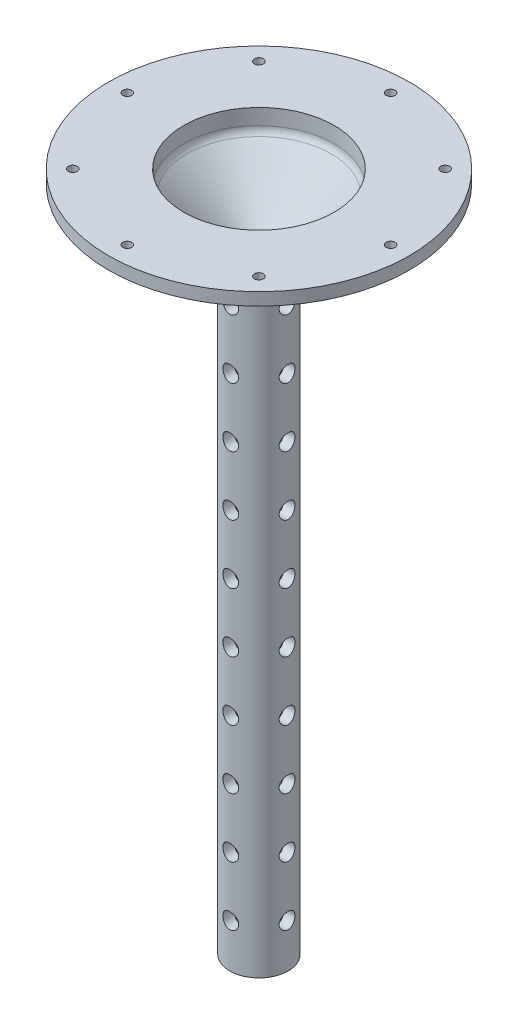
from build123d import *

# Parameters (mm, degrees)
SKETCH1_R                  = 38.1
BOSS_EXTRUDE1_DEPTH        = 3.175
TAP_DRILL_FOR_4_40_TAP1_D  = 2.2606
CIRPATTERN1_COUNT          = 8
SKETCH5_R                  = 25.4
BOSS_EXTRUDE2_DEPTH        = 19.05
CUT_EXTRUDE1_DEPTH         = 59.285252208
CUT_EXTRUDE1_DEPTH_BACK    = 59.285252208
SKETCH6_R                  = 4.7625
SKETCH7_R                  = 19.05
CUT_EXTRUDE2_DEPTH         = 5.08
CHAMFER1_SIZE              = 16.51
FILLET1_R                  = 2.54
FILLET2_R                  = 2.54
BOSS_EXTRUDE3_START        = 150
SKETCH10_R                 = 7.39
SKETCH10_R_2               = 4.7625
BOSS_EXTRUDE3_DEPTH        = 150
SKETCH11_R                 = 2
CUT_EXTRUDE3_DEPTH         = 178.429204287
CIRPATTERN2_COUNT          = 4
LPATTERN1_COUNT            = 10
LPATTERN1_PITCH            = 15
LPATTERN1_COPY_1_SKETCH_R  = 2
LPATTERN1_COPY_1_DEPTH     = 178.429204287
LPATTERN1_COPY_2_SKETCH_R  = 2
LPATTERN1_COPY_2_DEPTH     = 178.429204287
LPATTERN1_COPY_3_SKETCH_R  = 2
LPATTERN1_COPY_3_DEPTH     = 178.429204287
LPATTERN1_COPY_4_SKETCH_R  = 2
LPATTERN1_COPY_4_DEPTH     = 178.429204287
LPATTERN1_COPY_5_SKETCH_R  = 2
LPATTERN1_COPY_5_DEPTH     = 178.429204287
LPATTERN1_COPY_6_SKETCH_R  = 2
LPATTERN1_COPY_6_DEPTH     = 178.429204287
LPATTERN1_COPY_7_SKETCH_R  = 2
LPATTERN1_COPY_7_DEPTH     = 178.429204287
LPATTERN1_COPY_8_SKETCH_R  = 2
LPATTERN1_COPY_8_DEPTH     = 178.429204287
LPATTERN1_COPY_9_SKETCH_R  = 2
LPATTERN1_COPY_9_DEPTH     = 178.429204287
LPATTERN1_COPY_10_SKETCH_R = 2
LPATTERN1_COPY_10_DEPTH    = 178.429204287
LPATTERN1_COPY_11_SKETCH_R = 2
LPATTERN1_COPY_11_DEPTH    = 178.429204287
LPATTERN1_COPY_12_SKETCH_R = 2
LPATTERN1_COPY_12_DEPTH    = 178.429204287
LPATTERN1_COPY_13_SKETCH_R = 2
LPATTERN1_COPY_13_DEPTH    = 178.429204287
LPATTERN1_COPY_14_SKETCH_R = 2
LPATTERN1_COPY_14_DEPTH    = 178.429204287
LPATTERN1_COPY_15_SKETCH_R = 2
LPATTERN1_COPY_15_DEPTH    = 178.429204287
LPATTERN1_COPY_16_SKETCH_R = 2
LPATTERN1_COPY_16_DEPTH    = 178.429204287
LPATTERN1_COPY_17_SKETCH_R = 2
LPATTERN1_COPY_17_DEPTH    = 178.429204287
LPATTERN1_COPY_18_SKETCH_R = 2
LPATTERN1_COPY_18_DEPTH    = 178.429204287
LPATTERN1_COPY_19_SKETCH_R = 2
LPATTERN1_COPY_19_DEPTH    = 178.429204287
LPATTERN1_COPY_20_SKETCH_R = 2
LPATTERN1_COPY_20_DEPTH    = 178.429204287
LPATTERN1_COPY_21_SKETCH_R = 2
LPATTERN1_COPY_21_DEPTH    = 178.429204287
LPATTERN1_COPY_22_SKETCH_R = 2
LPATTERN1_COPY_22_DEPTH    = 178.429204287
LPATTERN1_COPY_23_SKETCH_R = 2
LPATTERN1_COPY_23_DEPTH    = 178.429204287
LPATTERN1_COPY_24_SKETCH_R = 2
LPATTERN1_COPY_24_DEPTH    = 178.429204287
LPATTERN1_COPY_25_SKETCH_R = 2
LPATTERN1_COPY_25_DEPTH    = 178.429204287
LPATTERN1_COPY_26_SKETCH_R = 2
LPATTERN1_COPY_26_DEPTH    = 178.429204287
LPATTERN1_COPY_27_SKETCH_R = 2
LPATTERN1_COPY_27_DEPTH    = 178.429204287


with BuildPart() as part:
    # Sketch1 → Boss-Extrude1 (new body)
    with BuildSketch(Plane(origin=(0, 0, 0), x_dir=(1, 0, 0), z_dir=(0, 1, 0))):
        with Locations(Location((0, 0, 0), (0, 0, 270))):
            Circle(SKETCH1_R)
    extrude(amount=BOSS_EXTRUDE1_DEPTH)

    # Tap Drill for #4-40 Tap1 (through all)
    with Locations(Plane(origin=(0, 0, 0), x_dir=(-1, 0, 0), z_dir=(0, -1, 0))):
        with Locations((0, -33.3375)):
            tap_drill_for_4_40_tap1 = Hole(TAP_DRILL_FOR_4_40_TAP1_D / 2)

    # CirPattern1: Tap Drill for #4-40 Tap1 ×8 about axis
    cirpattern1_axis = Axis((0, 0, 0), (0, 1, 0))
    for i in range(1, CIRPATTERN1_COUNT):
        add(tap_drill_for_4_40_tap1.rotate(cirpattern1_axis, i * 360 / CIRPATTERN1_COUNT), mode=Mode.SUBTRACT)

    # Sketch5 → Boss-Extrude2 (add)
    with BuildSketch(Plane.XZ):
        with Locations(Location((0, 0, 0), (0, 0, 90))):
            Circle(SKETCH5_R)
    extrude(amount=BOSS_EXTRUDE2_DEPTH)

    # Sketch6 → Cut-Extrude1 (cut, two sides: drawn at the far end of the back side and taken through both)
    with BuildSketch(Plane.XZ.offset(19.05).offset(-CUT_EXTRUDE1_DEPTH_BACK)):
        with Locations(Location((0, 0, 0), (0, 0, 270))):
            Circle(SKETCH6_R)
    extrude(amount=CUT_EXTRUDE1_DEPTH + CUT_EXTRUDE1_DEPTH_BACK, mode=Mode.SUBTRACT)

    # Sketch7 → Cut-Extrude2 (cut)
    with BuildSketch(Plane(origin=(0, 3.175, 0), x_dir=(1, 0, 0), z_dir=(0, 1, 0))):
        with Locations(Location((0, 0, 0), (0, 0, 270))):
            Circle(SKETCH7_R)
    extrude(amount=-CUT_EXTRUDE2_DEPTH, mode=Mode.SUBTRACT)

    # Cut-Loft1: read off the stored shape, not the designer's step
    # Cut-Loft1: loft between two sections, ruled curve by curve
    cut_loft1_from = [
        Edge.make_bspline([(0, -1.905, 19.05), (-38.1, -1.905, 19.05), (-38.1, -1.905, -19.05), (0, -1.905, -19.05), (38.1, -1.905, -19.05), (38.1, -1.905, 19.05), (0, -1.905, 19.05)], [0, 0, 0, 0, 0.5, 0.5, 0.5, 1, 1, 1, 1], 3, [1, 0.333333333, 0.333333333, 1, 0.333333333, 0.333333333, 1]),
    ]
    cut_loft1_to = [
        Edge.make_bspline([(-1.300975579, -15.875, 4.58136102), (-10.463697618, -15.875, 1.979409862), (-7.86174646, -15.875, -7.183312178), (1.300975579, -15.875, -4.58136102), (10.463697618, -15.875, -1.979409862), (7.86174646, -15.875, 7.183312178), (-1.300975579, -15.875, 4.58136102)], [0, 0, 0, 0, 0.5, 0.5, 0.5, 1, 1, 1, 1], 3, [1, 0.333333333, 0.333333333, 1, 0.333333333, 0.333333333, 1]),
    ]
    cut_loft1 = Solid(Shell([*[Face.make_surface_from_curves(cut_loft1_from[k], cut_loft1_to[k]) for k in range(1)], Face(Wire(cut_loft1_from)), Face(Wire(cut_loft1_to))]))
    add(cut_loft1, mode=Mode.SUBTRACT)

    # Chamfer1
    chamfer1_edges = [part.edges().sort_by_distance(p)[0] for p in [
        (0, -19.05, -25.4),
    ]]
    chamfer(chamfer1_edges, length=CHAMFER1_SIZE)

    # Fillet1
    fillet1_edges = [part.edges().sort_by_distance(p)[0] for p in [
        (0, 0, -25.4),
    ]]
    fillet(fillet1_edges, radius=FILLET1_R - 0.0001)  # a hair under: the kernel refuses the full size

    # Fillet2
    fillet2_edges = [part.edges().sort_by_distance(p)[0] for p in [
        (0, -1.905, -19.05),
    ]]
    fillet(fillet2_edges, radius=FILLET2_R)

    # Sketch10 → Boss-Extrude3 (add)
    with BuildSketch(Plane.XZ.offset(19.05).offset(BOSS_EXTRUDE3_START)):
        with Locations(Location((0, 0, 0), (0, 0, 270))):
            Circle(SKETCH10_R)
        with Locations(Location((0, 0, 0), (0, 0, 270))):
            Circle(SKETCH10_R_2, mode=Mode.SUBTRACT)
    extrude(amount=-BOSS_EXTRUDE3_DEPTH)

    # Sketch11 → Cut-Extrude3 (cut, symmetric)
    with BuildSketch(Plane.XY):
        with Locations(Location((0, -23, 0), (0, 0, 270.000000026))):
            Circle(SKETCH11_R)
    cut_extrude3 = extrude(amount=CUT_EXTRUDE3_DEPTH, both=True, mode=Mode.SUBTRACT)

    # CirPattern2: Cut-Extrude3 ×4 about axis
    cirpattern2_axis = Axis((0, -169.05, 0), (0, 1, 0))
    for i in range(1, CIRPATTERN2_COUNT):
        add(cut_extrude3.rotate(cirpattern2_axis, i * 360 / CIRPATTERN2_COUNT), mode=Mode.SUBTRACT)

    # LPattern1: Cut-Extrude3 ×10
    with Locations(*[(0, -i * LPATTERN1_PITCH, 0) for i in range(1, LPATTERN1_COUNT)]):
        add(cut_extrude3, mode=Mode.SUBTRACT)

    # LPattern1 copy 1 sketch → LPattern1 copy 1 (cut, symmetric)
    with BuildSketch(Plane(origin=(0, -15, 0), x_dir=(0, 0, -1), z_dir=(1, 0, 0))):
        with Locations(Location((0, -23, 0), (0, 0, 270.000000026))):
            Circle(LPATTERN1_COPY_1_SKETCH_R)
    extrude(amount=LPATTERN1_COPY_1_DEPTH, both=True, mode=Mode.SUBTRACT)

    # LPattern1 copy 2 sketch → LPattern1 copy 2 (cut, symmetric)
    with BuildSketch(Plane(origin=(0, -30, 0), x_dir=(0, 0, -1), z_dir=(1, 0, 0))):
        with Locations(Location((0, -23, 0), (0, 0, 270.000000026))):
            Circle(LPATTERN1_COPY_2_SKETCH_R)
    extrude(amount=LPATTERN1_COPY_2_DEPTH, both=True, mode=Mode.SUBTRACT)

    # LPattern1 copy 3 sketch → LPattern1 copy 3 (cut, symmetric)
    with BuildSketch(Plane(origin=(0, -45, 0), x_dir=(0, 0, -1), z_dir=(1, 0, 0))):
        with Locations(Location((0, -23, 0), (0, 0, 270.000000026))):
            Circle(LPATTERN1_COPY_3_SKETCH_R)
    extrude(amount=LPATTERN1_COPY_3_DEPTH, both=True, mode=Mode.SUBTRACT)

    # LPattern1 copy 4 sketch → LPattern1 copy 4 (cut, symmetric)
    with BuildSketch(Plane(origin=(0, -60, 0), x_dir=(0, 0, -1), z_dir=(1, 0, 0))):
        with Locations(Location((0, -23, 0), (0, 0, 270.000000026))):
            Circle(LPATTERN1_COPY_4_SKETCH_R)
    extrude(amount=LPATTERN1_COPY_4_DEPTH, both=True, mode=Mode.SUBTRACT)

    # LPattern1 copy 5 sketch → LPattern1 copy 5 (cut, symmetric)
    with BuildSketch(Plane(origin=(0, -75, 0), x_dir=(0, 0, -1), z_dir=(1, 0, 0))):
        with Locations(Location((0, -23, 0), (0, 0, 270.000000026))):
            Circle(LPATTERN1_COPY_5_SKETCH_R)
    extrude(amount=LPATTERN1_COPY_5_DEPTH, both=True, mode=Mode.SUBTRACT)

    # LPattern1 copy 6 sketch → LPattern1 copy 6 (cut, symmetric)
    with BuildSketch(Plane(origin=(0, -90, 0), x_dir=(0, 0, -1), z_dir=(1, 0, 0))):
        with Locations(Location((0, -23, 0), (0, 0, 270.000000026))):
            Circle(LPATTERN1_COPY_6_SKETCH_R)
    extrude(amount=LPATTERN1_COPY_6_DEPTH, both=True, mode=Mode.SUBTRACT)

    # LPattern1 copy 7 sketch → LPattern1 copy 7 (cut, symmetric)
    with BuildSketch(Plane(origin=(0, -105, 0), x_dir=(0, 0, -1), z_dir=(1, 0, 0))):
        with Locations(Location((0, -23, 0), (0, 0, 270.000000026))):
            Circle(LPATTERN1_COPY_7_SKETCH_R)
    extrude(amount=LPATTERN1_COPY_7_DEPTH, both=True, mode=Mode.SUBTRACT)

    # LPattern1 copy 8 sketch → LPattern1 copy 8 (cut, symmetric)
    with BuildSketch(Plane(origin=(0, -120, 0), x_dir=(0, 0, -1), z_dir=(1, 0, 0))):
        with Locations(Location((0, -23, 0), (0, 0, 270.000000026))):
            Circle(LPATTERN1_COPY_8_SKETCH_R)
    extrude(amount=LPATTERN1_COPY_8_DEPTH, both=True, mode=Mode.SUBTRACT)

    # LPattern1 copy 9 sketch → LPattern1 copy 9 (cut, symmetric)
    with BuildSketch(Plane(origin=(0, -135, 0), x_dir=(0, 0, -1), z_dir=(1, 0, 0))):
        with Locations(Location((0, -23, 0), (0, 0, 270.000000026))):
            Circle(LPATTERN1_COPY_9_SKETCH_R)
    extrude(amount=LPATTERN1_COPY_9_DEPTH, both=True, mode=Mode.SUBTRACT)

    # LPattern1 copy 10 sketch → LPattern1 copy 10 (cut, symmetric)
    with BuildSketch(Plane(origin=(0, -15, 0), x_dir=(-1, 0, 0), z_dir=(0, 0, -1))):
        with Locations(Location((0, -23, 0), (0, 0, 270.000000026))):
            Circle(LPATTERN1_COPY_10_SKETCH_R)
    extrude(amount=LPATTERN1_COPY_10_DEPTH, both=True, mode=Mode.SUBTRACT)

    # LPattern1 copy 11 sketch → LPattern1 copy 11 (cut, symmetric)
    with BuildSketch(Plane(origin=(0, -30, 0), x_dir=(-1, 0, 0), z_dir=(0, 0, -1))):
        with Locations(Location((0, -23, 0), (0, 0, 270.000000026))):
            Circle(LPATTERN1_COPY_11_SKETCH_R)
    extrude(amount=LPATTERN1_COPY_11_DEPTH, both=True, mode=Mode.SUBTRACT)

    # LPattern1 copy 12 sketch → LPattern1 copy 12 (cut, symmetric)
    with BuildSketch(Plane(origin=(0, -45, 0), x_dir=(-1, 0, 0), z_dir=(0, 0, -1))):
        with Locations(Location((0, -23, 0), (0, 0, 270.000000026))):
            Circle(LPATTERN1_COPY_12_SKETCH_R)
    extrude(amount=LPATTERN1_COPY_12_DEPTH, both=True, mode=Mode.SUBTRACT)

    # LPattern1 copy 13 sketch → LPattern1 copy 13 (cut, symmetric)
    with BuildSketch(Plane(origin=(0, -60, 0), x_dir=(-1, 0, 0), z_dir=(0, 0, -1))):
        with Locations(Location((0, -23, 0), (0, 0, 270.000000026))):
            Circle(LPATTERN1_COPY_13_SKETCH_R)
    extrude(amount=LPATTERN1_COPY_13_DEPTH, both=True, mode=Mode.SUBTRACT)

    # LPattern1 copy 14 sketch → LPattern1 copy 14 (cut, symmetric)
    with BuildSketch(Plane(origin=(0, -75, 0), x_dir=(-1, 0, 0), z_dir=(0, 0, -1))):
        with Locations(Location((0, -23, 0), (0, 0, 270.000000026))):
            Circle(LPATTERN1_COPY_14_SKETCH_R)
    extrude(amount=LPATTERN1_COPY_14_DEPTH, both=True, mode=Mode.SUBTRACT)

    # LPattern1 copy 15 sketch → LPattern1 copy 15 (cut, symmetric)
    with BuildSketch(Plane(origin=(0, -90, 0), x_dir=(-1, 0, 0), z_dir=(0, 0, -1))):
        with Locations(Location((0, -23, 0), (0, 0, 270.000000026))):
            Circle(LPATTERN1_COPY_15_SKETCH_R)
    extrude(amount=LPATTERN1_COPY_15_DEPTH, both=True, mode=Mode.SUBTRACT)

    # LPattern1 copy 16 sketch → LPattern1 copy 16 (cut, symmetric)
    with BuildSketch(Plane(origin=(0, -105, 0), x_dir=(-1, 0, 0), z_dir=(0, 0, -1))):
        with Locations(Location((0, -23, 0), (0, 0, 270.000000026))):
            Circle(LPATTERN1_COPY_16_SKETCH_R)
    extrude(amount=LPATTERN1_COPY_16_DEPTH, both=True, mode=Mode.SUBTRACT)

    # LPattern1 copy 17 sketch → LPattern1 copy 17 (cut, symmetric)
    with BuildSketch(Plane(origin=(0, -120, 0), x_dir=(-1, 0, 0), z_dir=(0, 0, -1))):
        with Locations(Location((0, -23, 0), (0, 0, 270.000000026))):
            Circle(LPATTERN1_COPY_17_SKETCH_R)
    extrude(amount=LPATTERN1_COPY_17_DEPTH, both=True, mode=Mode.SUBTRACT)

    # LPattern1 copy 18 sketch → LPattern1 copy 18 (cut, symmetric)
    with BuildSketch(Plane(origin=(0, -135, 0), x_dir=(-1, 0, 0), z_dir=(0, 0, -1))):
        with Locations(Location((0, -23, 0), (0, 0, 270.000000026))):
            Circle(LPATTERN1_COPY_18_SKETCH_R)
    extrude(amount=LPATTERN1_COPY_18_DEPTH, both=True, mode=Mode.SUBTRACT)

    # LPattern1 copy 19 sketch → LPattern1 copy 19 (cut, symmetric)
    with BuildSketch(Plane(origin=(0, -15, 0), x_dir=(0, 0, 1), z_dir=(-1, 0, 0))):
        with Locations(Location((0, -23, 0), (0, 0, 270.000000026))):
            Circle(LPATTERN1_COPY_19_SKETCH_R)
    extrude(amount=LPATTERN1_COPY_19_DEPTH, both=True, mode=Mode.SUBTRACT)

    # LPattern1 copy 20 sketch → LPattern1 copy 20 (cut, symmetric)
    with BuildSketch(Plane(origin=(0, -30, 0), x_dir=(0, 0, 1), z_dir=(-1, 0, 0))):
        with Locations(Location((0, -23, 0), (0, 0, 270.000000026))):
            Circle(LPATTERN1_COPY_20_SKETCH_R)
    extrude(amount=LPATTERN1_COPY_20_DEPTH, both=True, mode=Mode.SUBTRACT)

    # LPattern1 copy 21 sketch → LPattern1 copy 21 (cut, symmetric)
    with BuildSketch(Plane(origin=(0, -45, 0), x_dir=(0, 0, 1), z_dir=(-1, 0, 0))):
        with Locations(Location((0, -23, 0), (0, 0, 270.000000026))):
            Circle(LPATTERN1_COPY_21_SKETCH_R)
    extrude(amount=LPATTERN1_COPY_21_DEPTH, both=True, mode=Mode.SUBTRACT)

    # LPattern1 copy 22 sketch → LPattern1 copy 22 (cut, symmetric)
    with BuildSketch(Plane(origin=(0, -60, 0), x_dir=(0, 0, 1), z_dir=(-1, 0, 0))):
        with Locations(Location((0, -23, 0), (0, 0, 270.000000026))):
            Circle(LPATTERN1_COPY_22_SKETCH_R)
    extrude(amount=LPATTERN1_COPY_22_DEPTH, both=True, mode=Mode.SUBTRACT)

    # LPattern1 copy 23 sketch → LPattern1 copy 23 (cut, symmetric)
    with BuildSketch(Plane(origin=(0, -75, 0), x_dir=(0, 0, 1), z_dir=(-1, 0, 0))):
        with Locations(Location((0, -23, 0), (0, 0, 270.000000026))):
            Circle(LPATTERN1_COPY_23_SKETCH_R)
    extrude(amount=LPATTERN1_COPY_23_DEPTH, both=True, mode=Mode.SUBTRACT)

    # LPattern1 copy 24 sketch → LPattern1 copy 24 (cut, symmetric)
    with BuildSketch(Plane(origin=(0, -90, 0), x_dir=(0, 0, 1), z_dir=(-1, 0, 0))):
        with Locations(Location((0, -23, 0), (0, 0, 270.000000026))):
            Circle(LPATTERN1_COPY_24_SKETCH_R)
    extrude(amount=LPATTERN1_COPY_24_DEPTH, both=True, mode=Mode.SUBTRACT)

    # LPattern1 copy 25 sketch → LPattern1 copy 25 (cut, symmetric)
    with BuildSketch(Plane(origin=(0, -105, 0), x_dir=(0, 0, 1), z_dir=(-1, 0, 0))):
        with Locations(Location((0, -23, 0), (0, 0, 270.000000026))):
            Circle(LPATTERN1_COPY_25_SKETCH_R)
    extrude(amount=LPATTERN1_COPY_25_DEPTH, both=True, mode=Mode.SUBTRACT)

    # LPattern1 copy 26 sketch → LPattern1 copy 26 (cut, symmetric)
    with BuildSketch(Plane(origin=(0, -120, 0), x_dir=(0, 0, 1), z_dir=(-1, 0, 0))):
        with Locations(Location((0, -23, 0), (0, 0, 270.000000026))):
            Circle(LPATTERN1_COPY_26_SKETCH_R)
    extrude(amount=LPATTERN1_COPY_26_DEPTH, both=True, mode=Mode.SUBTRACT)

    # LPattern1 copy 27 sketch → LPattern1 copy 27 (cut, symmetric)
    with BuildSketch(Plane(origin=(0, -135, 0), x_dir=(0, 0, 1), z_dir=(-1, 0, 0))):
        with Locations(Location((0, -23, 0), (0, 0, 270.000000026))):
            Circle(LPATTERN1_COPY_27_SKETCH_R)
    extrude(amount=LPATTERN1_COPY_27_DEPTH, both=True, mode=Mode.SUBTRACT)


solid = part.part
